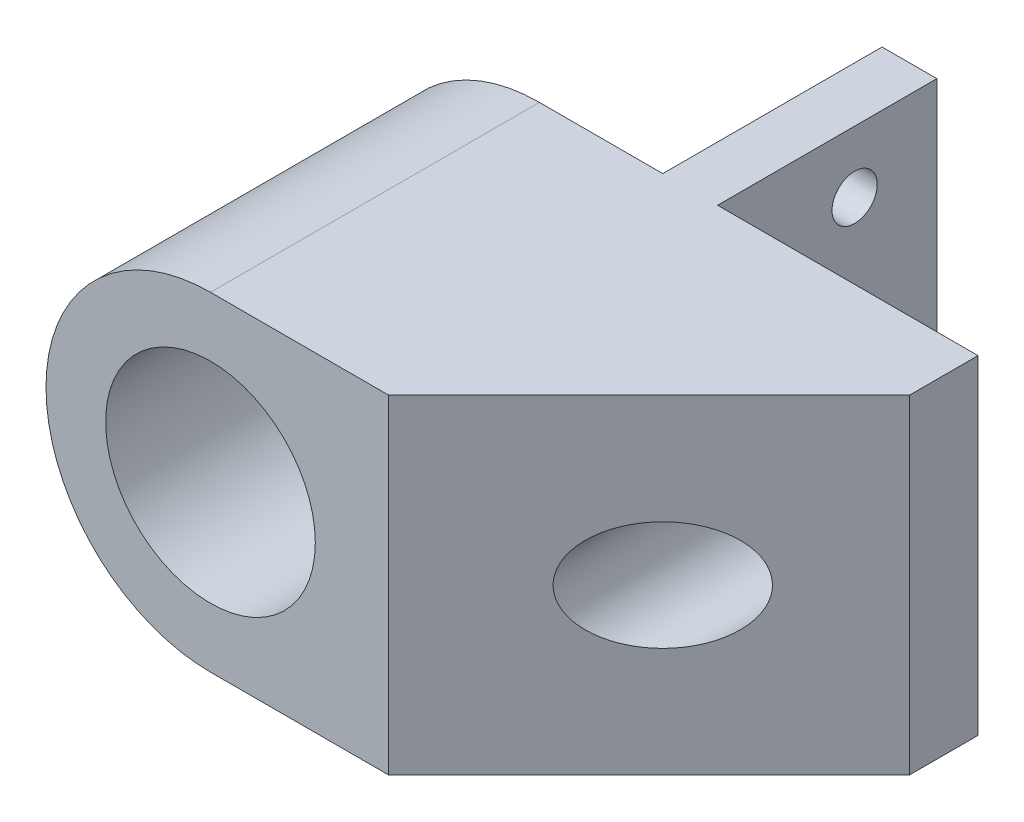
from build123d import *

# Parameters (mm, degrees)
ESBO_O1_R                = 7.65
ESBO_O1_R_2              = 1.6
RESSALTO_EXTRUS_O1_DEPTH = 40
ESBO_O2_W                = 19
ESBO_O2_H                = 20
ESBO_O2_W_2              = 21
ESBO_O2_H_2              = 16
CORTE_EXTRUS_O1_DEPTH    = 67.603303221
ESBO_O3_R                = 1.65
ESBO_O3_W                = 40
ESBO_O3_H                = 6
CORTE_EXTRUS_O2_DEPTH    = 20
CHANFRO2_SIZE            = 20
ESBO_O4_R                = 4
CORTE_EXTRUS_O3_DEPTH    = 19


with BuildPart() as part:
    # Esboço1 → Ressalto-extrusão1 (new body)
    with BuildSketch(Plane.XY):
        with BuildLine():
            Line((0, 0), (-19, 0))
            Line((-19, 0), (-19, 6))
            Line((-19, 6), (-23, 6))
            Line((-23, 6), (-23, 0))
            Line((-23, 0), (-32, 0))
            ThreePointArc((-32, 0), (-44, -12), (-32, -24))
            Line((-32, -24), (-23, -24))
            Line((-23, -24), (-23, -30))
            Line((-23, -30), (-19, -30))
            Line((-19, -30), (-19, -24))
            Line((-19, -24), (0, -24))
            Line((0, -24), (0, 0))
        make_face()
        with Locations((-32, -12)):
            Circle(ESBO_O1_R, mode=Mode.SUBTRACT)
        with Locations((-9, -12)):
            Circle(ESBO_O1_R_2, mode=Mode.SUBTRACT)
    extrude(amount=RESSALTO_EXTRUS_O1_DEPTH)

    # Esboço2 → Corte-extrusão1 (cut, through all)
    with BuildSketch(Plane(origin=(0, 0, 0), x_dir=(1, 0, 0), z_dir=(0, 1, 0))):
        with Locations((-9.5, -30)):
            Rectangle(ESBO_O2_W, ESBO_O2_H)
        with Locations((-33.5, -8)):
            Rectangle(ESBO_O2_W_2, ESBO_O2_H_2)
        with Locations((-9.5, -8)):
            Rectangle(ESBO_O2_W, ESBO_O2_H_2)
    extrude(amount=-CORTE_EXTRUS_O1_DEPTH, mode=Mode.SUBTRACT)

    # Esboço3 → Corte-extrusão2 (cut)
    with BuildSketch(Plane.ZY.offset(23)):
        with Locations((6, -4.5)):
            Circle(ESBO_O3_R)
        with Locations((6, -19.5)):
            Circle(ESBO_O3_R)
        with Locations((20, 3)):
            Rectangle(ESBO_O3_W, ESBO_O3_H)
        with Locations((20, -27)):
            Rectangle(ESBO_O3_W, ESBO_O3_H)
    extrude(amount=-CORTE_EXTRUS_O2_DEPTH, mode=Mode.SUBTRACT)

    # Chanfro2
    # the kernel refuses this chamfer: 20 mm, written as the material it adds along each edge
    with BuildSketch(Plane(origin=(-19, 0, 20), x_dir=(0.9996219169112968, 0, -0.02749587661058649), z_dir=(0, -1, 0))) as chanfro2_piece_1_section:
        Polygon((CHANFRO2_SIZE * 0.999621916911, CHANFRO2_SIZE * 0.0274958766106), (-CHANFRO2_SIZE * 0.0274958766106, CHANFRO2_SIZE * 0.999621916911), (0, 0), align=None)
    chanfro2_piece_1 = extrude(amount=24, mode=Mode.PRIVATE)
    chanfro2_piece_1 = chanfro2_piece_1 - Plane(origin=(-9, -12, 26.656748397), x_dir=(1, 0, 0), z_dir=(0, 0, -1)) * Cylinder(1.6, 128, mode=Mode.PRIVATE)
    chanfro2_piece_1 = split(chanfro2_piece_1, bisect_by=Plane(origin=(0, -11.999999472, 26.656748397), z_dir=(-1, 0, 0)), keep=Keep.TOP, mode=Mode.PRIVATE)
    chanfro2_piece_1 = split(chanfro2_piece_1, bisect_by=Plane(origin=(-12.552402044, -11.999999472, 40), z_dir=(0, 0, -1)), keep=Keep.TOP, mode=Mode.PRIVATE)
    add(chanfro2_piece_1)

    # Esboço4 → Corte-extrusão3 (cut)
    with BuildSketch(Plane.XY.offset(40)):
        with Locations((-9, -12)):
            Circle(ESBO_O4_R)
    extrude(amount=-CORTE_EXTRUS_O3_DEPTH, mode=Mode.SUBTRACT)


solid = part.part
